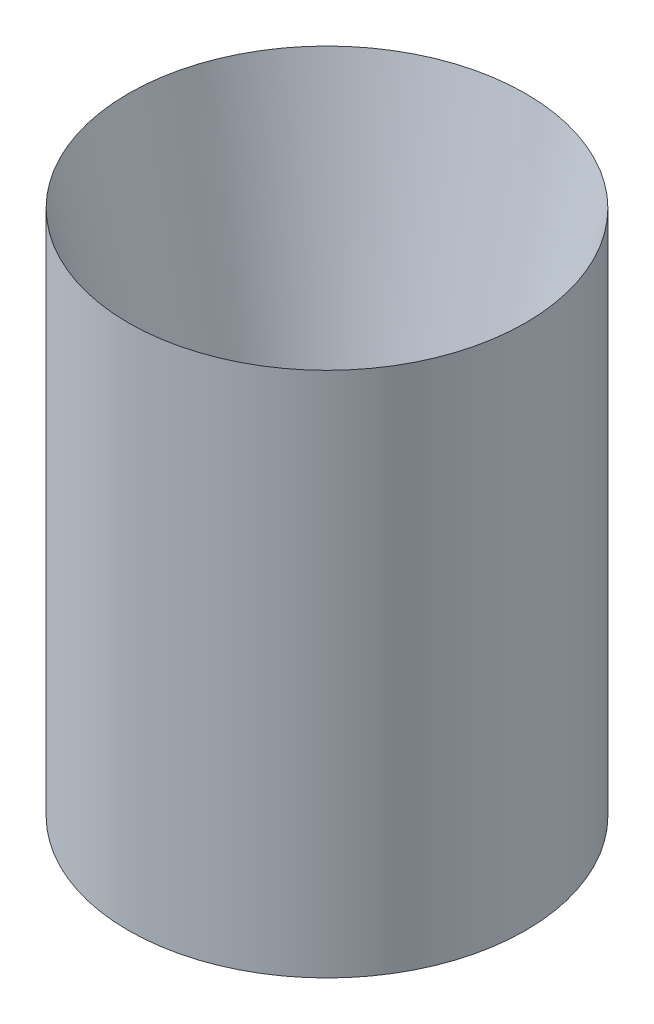
from build123d import *


with BuildPart() as part:
    # Sketch1 → Revolve1 (revolve)
    with BuildSketch(Plane(origin=(0, 0, 0), x_dir=(0, 1, 0), z_dir=(0, 0, 1))):
        Polygon((0, 22.225), (0, 53.975), (143.002, 53.975), align=None)
    revolve(axis=Axis((0, 0, 0), (0, 1, 0)))


solid = part.part
